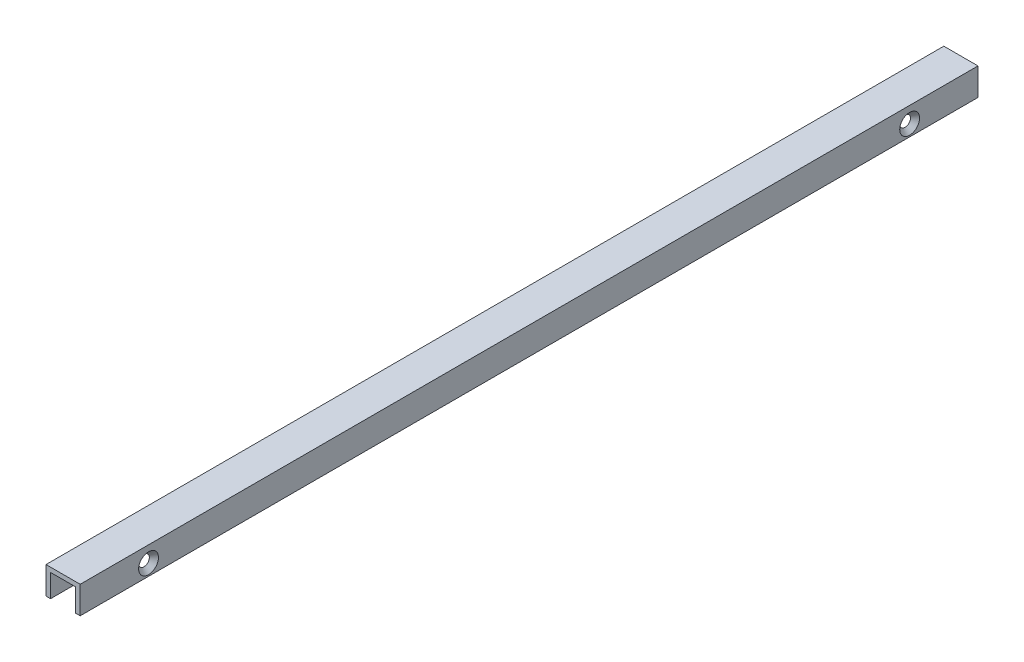
from build123d import *

# Parameters (mm, degrees)
SM_BASE_FLANGE_2_DEPTH = 394
SKETCH_7_R             = 2.3
CUT_EXTRUDE_1_DEPTH    = 2
CHAMFER_1_SIZE         = 2.05


# Sheet-metal steps are written as plain solids
with BuildPart() as part:
    # Эскиз6 → Базовая кромка2 (new body)
    with BuildSketch(Plane.XY):
        Polygon((0, 0), (-2, 0), (-2, 12), (13, 12), (13, 0), (11, 0), (11, 10), (0, 10), align=None)
    extrude(amount=-SM_BASE_FLANGE_2_DEPTH)

    # Эскиз7 → Вырез-Вытянуть1 (cut)
    with BuildSketch(Plane(origin=(13, 0, 0), x_dir=(0, 0, -1), z_dir=(1, 0, 0))):
        with Locations((30, 5)):
            Circle(SKETCH_7_R)
        with Locations((364, 5)):
            Circle(SKETCH_7_R)
    extrude(amount=-CUT_EXTRUDE_1_DEPTH, mode=Mode.SUBTRACT)

    # Фаска1
    # the kernel refuses this chamfer: 2.05 mm, written as the material it takes off along each edge
    with BuildSketch(Plane(origin=(13, 5, -364), x_dir=(0, 0, -1), z_dir=(0, -1, 0))) as chamfer_1_piece_1:
        Polygon((2.3 + CHAMFER_1_SIZE, 0), (2.3, -CHAMFER_1_SIZE), (2.3, 0), align=None)
    revolve(axis=Axis((13, 5, -364), (1, 0, 0)), mode=Mode.SUBTRACT)
    with BuildSketch(Plane(origin=(13, 5, -30), x_dir=(0, 0, -1), z_dir=(0, -1, 0))) as chamfer_1_piece_2:
        Polygon((2.3 + CHAMFER_1_SIZE, 0), (2.3, -CHAMFER_1_SIZE), (2.3, 0), align=None)
    revolve(axis=Axis((13, 5, -30), (1, 0, 0)), mode=Mode.SUBTRACT)


solid = part.part
